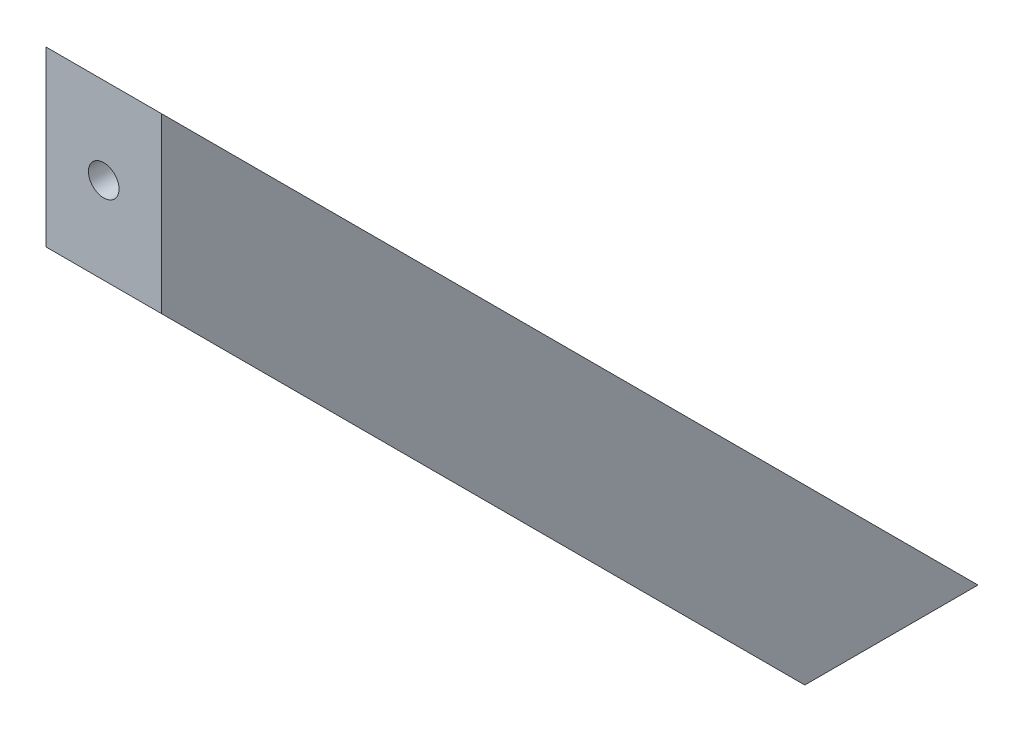
from build123d import *

# Parameters (mm, degrees)
BOSS_EXTRUDE1_DEPTH = 20
SKETCH3_R           = 2.65
CUT_EXTRUDE1_DEPTH  = 182.148333213
SKETCH4_R           = 2.65
CUT_EXTRUDE2_DEPTH  = 201.997512422
SKETCH5_R           = 5.5
CUT_EXTRUDE3_DEPTH  = 198.511484318
SKETCH6_R           = 5.5
CUT_EXTRUDE4_DEPTH  = 178.272403558


with BuildPart() as part:
    # Sketch2 → Boss-Extrude1 (new body)
    with BuildSketch(Plane(origin=(0, 0, 0), x_dir=(0, 0, -1), z_dir=(1, 0, 0))):
        Polygon((0, 0), (-111.421356237, 111.421356237), (-111.421356237, 141.421356237), (30, 0), align=None)
    extrude(amount=BOSS_EXTRUDE1_DEPTH)

    # Sketch3 → Cut-Extrude1 (cut, through all)
    with BuildSketch(Plane.XZ):
        with Locations((10, -15)):
            Circle(SKETCH3_R)
    extrude(amount=-CUT_EXTRUDE1_DEPTH, mode=Mode.SUBTRACT)

    # Sketch4 → Cut-Extrude2 (cut, through all)
    with BuildSketch(Plane.XY.offset(111.421356237)):
        with Locations((10, 126.421356237)):
            Circle(SKETCH4_R)
    extrude(amount=-CUT_EXTRUDE2_DEPTH, mode=Mode.SUBTRACT)

    # Sketch5 → Cut-Extrude3 (cut, through all)
    with BuildSketch(Plane.XY.offset(106.421356237)):
        with Locations((10, 126.421356237)):
            Circle(SKETCH5_R)
    extrude(amount=-CUT_EXTRUDE3_DEPTH, mode=Mode.SUBTRACT)

    # Sketch6 → Cut-Extrude4 (cut, through all)
    with BuildSketch(Plane(origin=(0, 5, 0), x_dir=(-1, 0, 0), z_dir=(0, -1, 0))):
        with Locations((-10, 15)):
            Circle(SKETCH6_R)
    extrude(amount=-CUT_EXTRUDE4_DEPTH, mode=Mode.SUBTRACT)


solid = part.part
